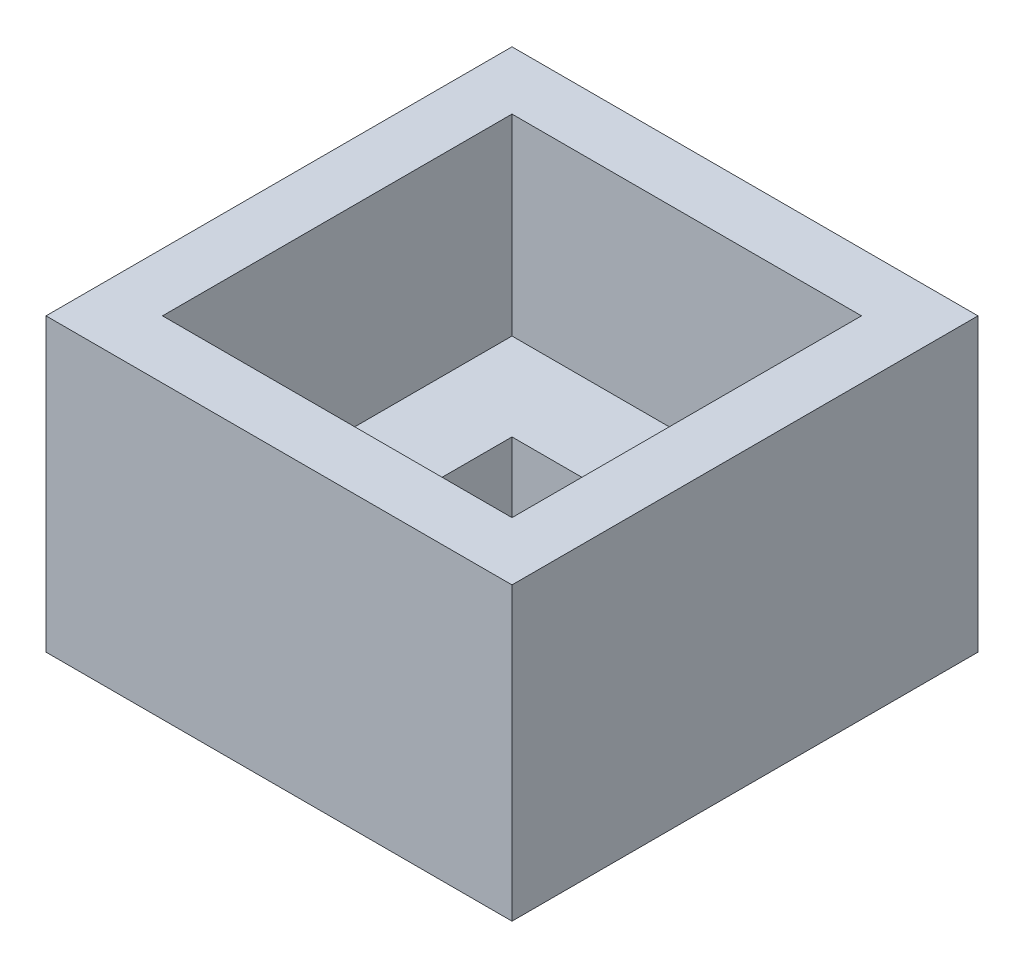
from build123d import *

# Parameters (mm, degrees)
SKETCH1_W           = 101.6
SKETCH1_H           = 101.6
SKETCH1_W_2         = 38.1
SKETCH1_H_2         = 38.1
BOSS_EXTRUDE1_DEPTH = 76.2
SKETCH3_W           = 76.2
SKETCH3_H           = 76.2
CUT_EXTRUDE2_DEPTH  = 54.61
SKETCH5_W           = 101.6
SKETCH5_H           = 101.6
SKETCH5_W_2         = 76.2
SKETCH5_H_2         = 76.2
CUT_EXTRUDE3_DEPTH  = 12.7


with BuildPart() as part:
    # Sketch1 → Boss-Extrude1 (new body)
    with BuildSketch(Plane(origin=(0, 0, 0), x_dir=(1, 0, 0), z_dir=(0, 1, 0))):
        Rectangle(SKETCH1_W, SKETCH1_H)
        Rectangle(SKETCH1_W_2, SKETCH1_H_2, mode=Mode.SUBTRACT)
    extrude(amount=BOSS_EXTRUDE1_DEPTH)

    # Sketch3 → Cut-Extrude2 (cut)
    with BuildSketch(Plane(origin=(0, 76.2, 0), x_dir=(1, 0, 0), z_dir=(0, 1, 0))):
        Rectangle(SKETCH3_W, SKETCH3_H)
    extrude(amount=-CUT_EXTRUDE2_DEPTH, mode=Mode.SUBTRACT)

    # Sketch5 → Cut-Extrude3 (cut)
    with BuildSketch(Plane(origin=(0, 76.2, 0), x_dir=(1, 0, 0), z_dir=(0, 1, 0))):
        Rectangle(SKETCH5_W, SKETCH5_H)
        Rectangle(SKETCH5_W_2, SKETCH5_H_2, mode=Mode.SUBTRACT)
    extrude(amount=-CUT_EXTRUDE3_DEPTH, mode=Mode.SUBTRACT)


solid = part.part
